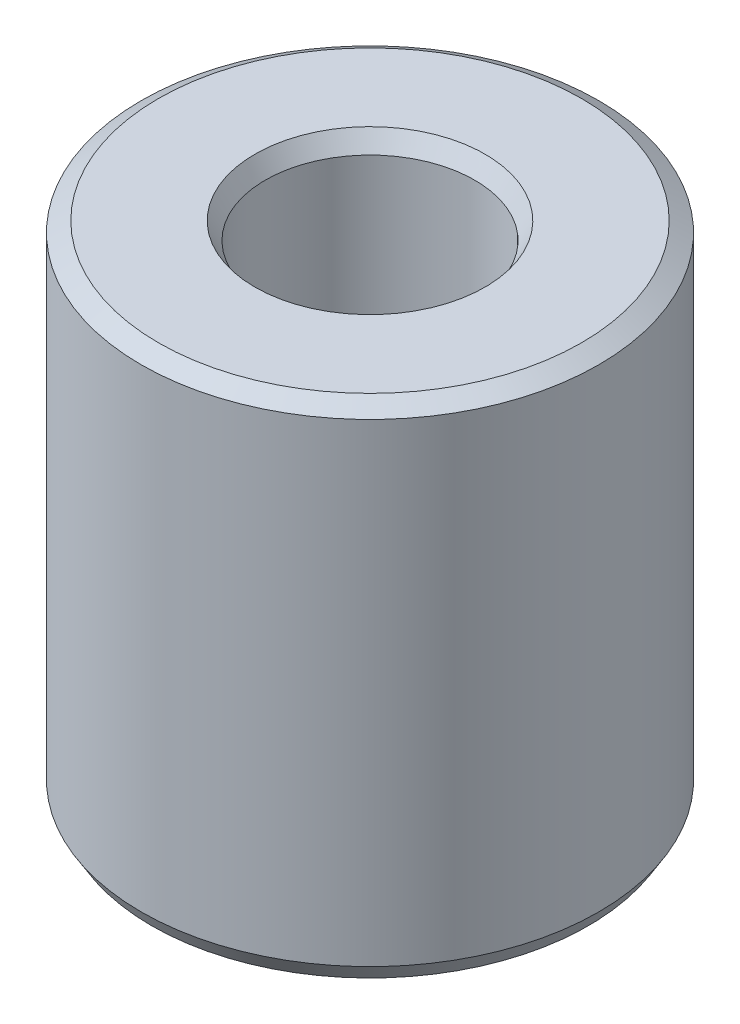
from build123d import *
from OCP.BRepFilletAPI import BRepFilletAPI_MakeChamfer

# Parameters (mm, degrees)
SKETCH1_R           = 27.5
BOSS_EXTRUDE1_DEPTH = 60.279143377
SKETCH2_R           = 12.587071651
CUT_EXTRUDE1_DEPTH  = 72.736149369
CHAMFER1_SIZE       = 1.252354337
CHAMFER1_SIZE2      = 2.069834859


with BuildPart() as part:
    # Sketch1 → Boss-Extrude1 (new body)
    with BuildSketch(Plane(origin=(0, 0, 0), x_dir=(1, 0, 0), z_dir=(0, 1, 0))):
        Circle(SKETCH1_R)
    extrude(amount=BOSS_EXTRUDE1_DEPTH)

    # Sketch2 → Cut-Extrude1 (cut, through all)
    with BuildSketch(Plane(origin=(0, 0, 0), x_dir=(1, 0, 0), z_dir=(0, 1, 0))):
        Circle(SKETCH2_R)
    extrude(amount=CUT_EXTRUDE1_DEPTH, mode=Mode.SUBTRACT)

    # Chamfer1: one chamfer whose edges measure the first distance from different faces: ONE call of the kernel's chamfer builder (chamfer() names one face for all edges)
    chamfer1_edges_1 = [part.edges().sort_by_distance(p)[0] for p in [
        (-12.587071651, 60.279143377, 0),
    ]]
    chamfer1_side_1 = [part.faces().sort_by_distance(p)[0] for p in [
        (-26.722182541, 60.279143377, 0),
    ]]
    chamfer1_edges_2 = [part.edges().sort_by_distance(p)[0] for p in [
        (-12.587071651, 0, 0),
    ]]
    chamfer1_side_2 = [part.faces().sort_by_distance(p)[0] for p in [
        (-12.587071651, 30.139571689, 0),
    ]]
    chamfer1_edges_3 = [part.edges().sort_by_distance(p)[0] for p in [
        (-27.5, 0, 0),
    ]]
    chamfer1_side_3 = [part.faces().sort_by_distance(p)[0] for p in [
        (-26.722182541, 0, 0),
    ]]
    chamfer1_edges_4 = [part.edges().sort_by_distance(p)[0] for p in [
        (-27.5, 60.279143377, 0),
    ]]
    chamfer1_side_4 = [part.faces().sort_by_distance(p)[0] for p in [
        (-27.5, 30.139571689, 0),
    ]]
    chamfer1 = BRepFilletAPI_MakeChamfer(part.part.solid().wrapped)
    for e in chamfer1_edges_1:
        chamfer1.Add(CHAMFER1_SIZE, CHAMFER1_SIZE2, e.wrapped, chamfer1_side_1[0].wrapped)  # the first distance lies on this face
    for e in chamfer1_edges_2:
        chamfer1.Add(CHAMFER1_SIZE, CHAMFER1_SIZE2, e.wrapped, chamfer1_side_2[0].wrapped)  # the first distance lies on this face
    for e in chamfer1_edges_3:
        chamfer1.Add(CHAMFER1_SIZE, CHAMFER1_SIZE2, e.wrapped, chamfer1_side_3[0].wrapped)  # the first distance lies on this face
    for e in chamfer1_edges_4:
        chamfer1.Add(CHAMFER1_SIZE, CHAMFER1_SIZE2, e.wrapped, chamfer1_side_4[0].wrapped)  # the first distance lies on this face
    add(Compound.cast(chamfer1.Shape()), mode=Mode.REPLACE)


solid = part.part
